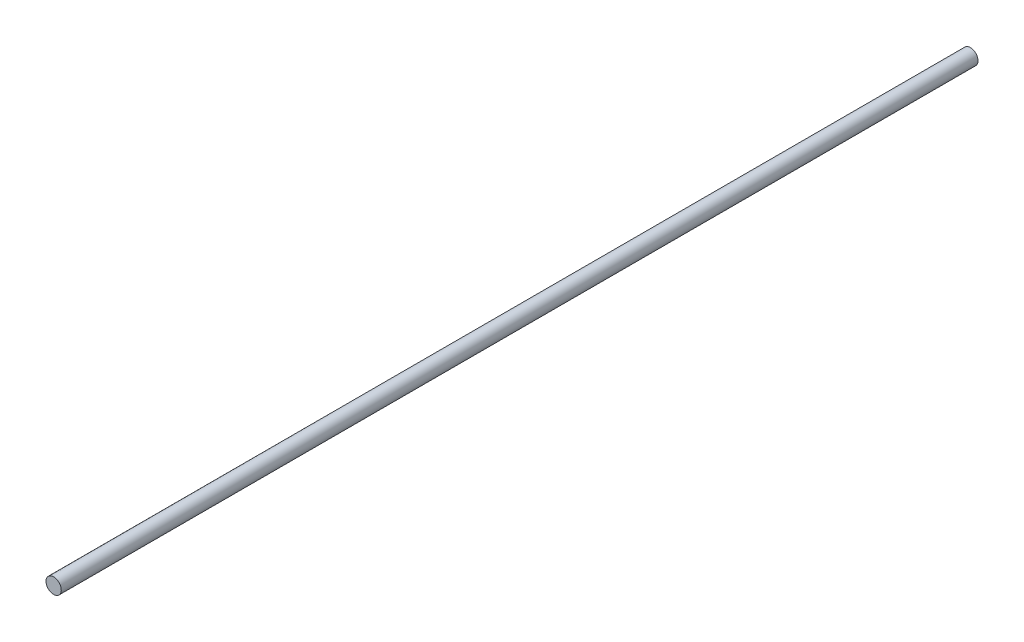
from build123d import *

# Parameters (mm, degrees)
SKETCH1_R           = 5
BOSS_EXTRUDE1_DEPTH = 300


with BuildPart() as part:
    # Sketch1 → Boss-Extrude1 (new, symmetric)
    with BuildSketch(Plane.XY):
        Circle(SKETCH1_R)
    extrude(amount=BOSS_EXTRUDE1_DEPTH, both=True)


solid = part.part
